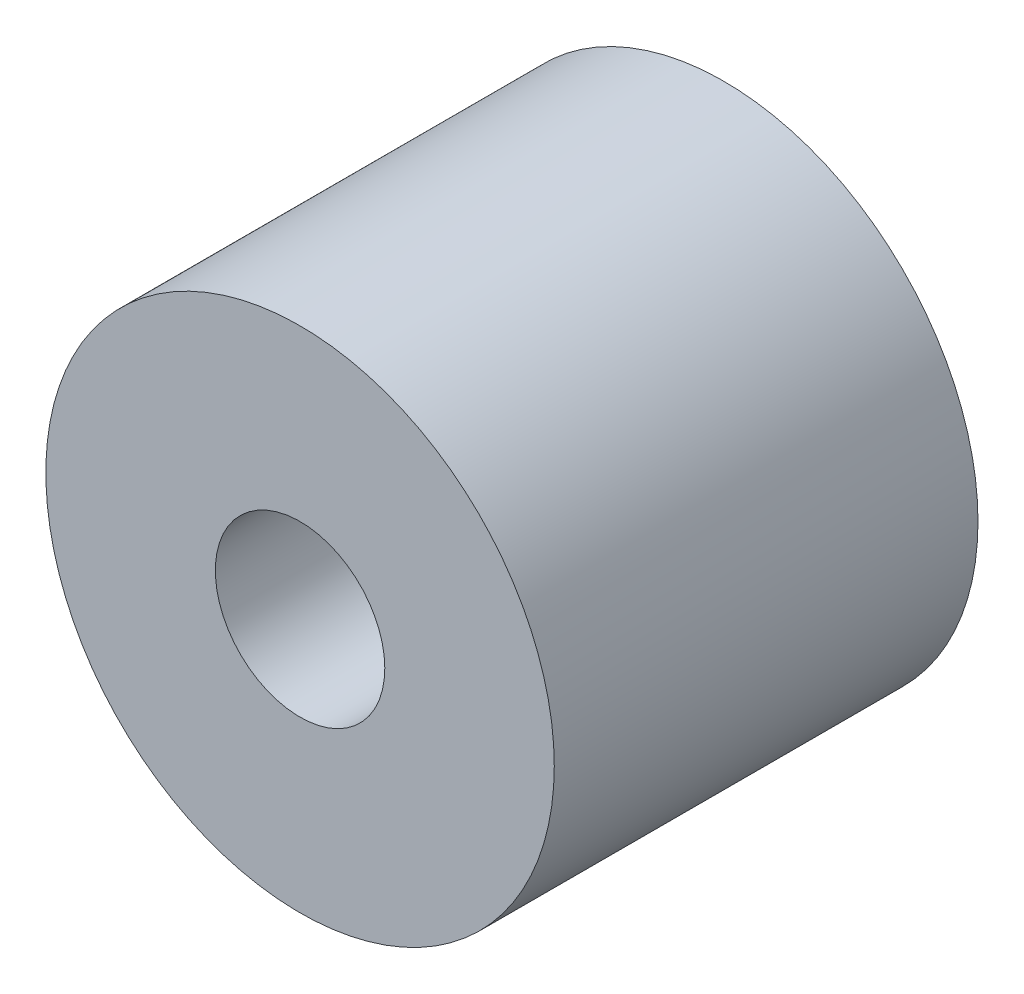
from build123d import *

# Parameters (mm, degrees)
SKETCH1_R           = 12
SKETCH1_R_2         = 4
BOSS_EXTRUDE1_DEPTH = 20


with BuildPart() as part:
    # Sketch1 → Boss-Extrude1 (new body)
    with BuildSketch(Plane.XY):
        Circle(SKETCH1_R)
        Circle(SKETCH1_R_2, mode=Mode.SUBTRACT)
    extrude(amount=BOSS_EXTRUDE1_DEPTH)


solid = part.part
